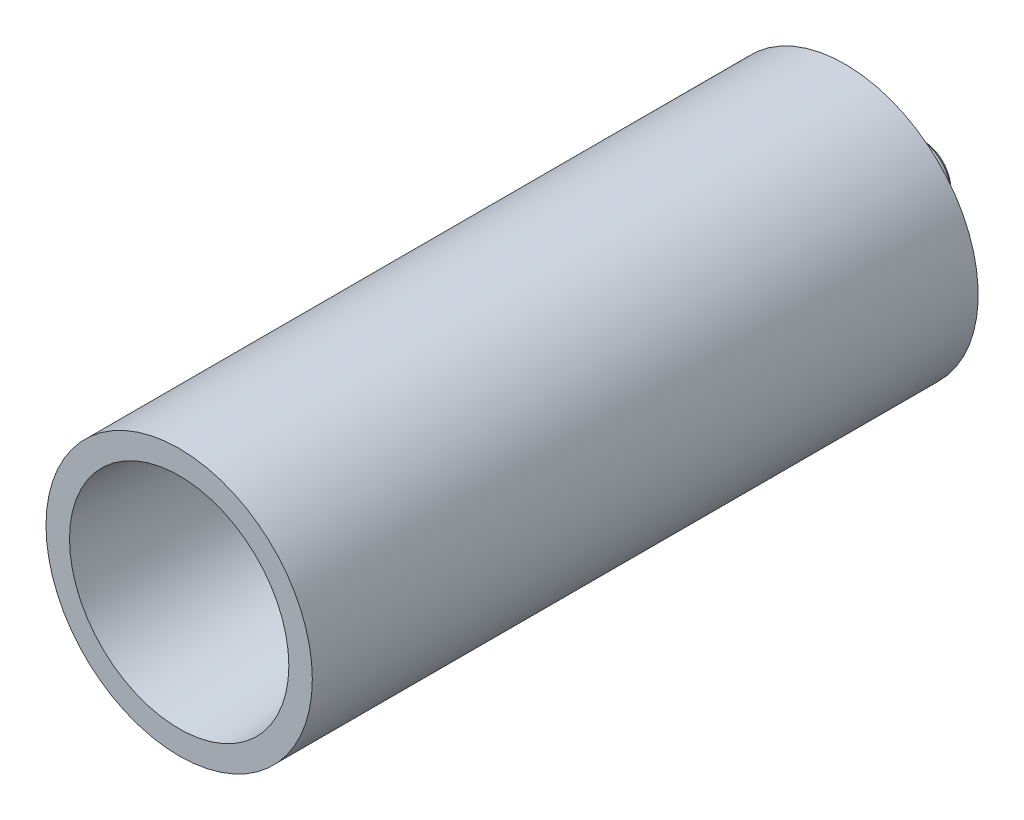
from build123d import *

# Parameters (mm, degrees)
SKETCH1_R           = 17
SKETCH1_R_2         = 12
BOSS_EXTRUDE1_DEPTH = 80
CHAMFER1_SIZE       = 2
CHAMFER1_SIZE2      = 22.860104606
BOSS_EXTRUDE2_START = 5
SKETCH2_R           = 17
BOSS_EXTRUDE2_DEPTH = 5
SKETCH3_R           = 9
SKETCH3_R_2         = 4
BOSS_EXTRUDE3_DEPTH = 3
BOSS_EXTRUDE4_START = 3
SKETCH3_3_R         = 4
BOSS_EXTRUDE4_DEPTH = 7
FILLET1_R           = 12
CHAMFER2_SIZE       = 0.5


with BuildPart() as part:
    # Sketch1 → Boss-Extrude1 (new body)
    with BuildSketch(Plane.XY):
        Circle(SKETCH1_R)
        Circle(SKETCH1_R_2, mode=Mode.SUBTRACT)
    extrude(amount=BOSS_EXTRUDE1_DEPTH)

    # Chamfer1
    chamfer1_edges = [part.edges().sort_by_distance(p)[0] for p in [
        (-12, 0, 80),
    ]]
    chamfer1_side = [part.faces().sort_by_distance(p)[0] for p in [
        (-16.519167389, 0, 80),
    ]]
    chamfer(chamfer1_edges, length=CHAMFER1_SIZE, length2=CHAMFER1_SIZE2, reference=chamfer1_side[0])

    # Sketch2 → Boss-Extrude2 (add)
    with BuildSketch(Plane(origin=(0, 0, 0), x_dir=(-1, 0, 0), z_dir=(0, 0, -1)).offset(BOSS_EXTRUDE2_START)):
        Circle(SKETCH2_R)
    extrude(amount=-BOSS_EXTRUDE2_DEPTH)

    # Sketch3 → Boss-Extrude3 (add)
    # profile 1 of 2: a face of its own
    with BuildSketch(Plane(origin=(0, 0, -5), x_dir=(-1, 0, 0), z_dir=(0, 0, -1))):
        Circle(SKETCH3_R)
        Circle(SKETCH3_R_2, mode=Mode.SUBTRACT)
    # profile 2 of 2: a face of its own
    with BuildSketch(Plane(origin=(0, 0, -5), x_dir=(-1, 0, 0), z_dir=(0, 0, -1))):
        Circle(SKETCH3_R_2)
    extrude(amount=BOSS_EXTRUDE3_DEPTH)

    # Sketch3<3> → Boss-Extrude4 (add)
    with BuildSketch(Plane(origin=(0, 0, -5), x_dir=(-1, 0, 0), z_dir=(0, 0, -1)).offset(BOSS_EXTRUDE4_START)):
        Circle(SKETCH3_3_R)
    extrude(amount=BOSS_EXTRUDE4_DEPTH)

    # Fillet1
    # the kernel refuses this fillet: 12 mm, written as the material it adds along each edge
    with BuildSketch(Plane(origin=(0, 0, -5), x_dir=(-1, 0, 0), z_dir=(0, -1, 0))) as fillet1_piece_1:
        with BuildLine():
            CenterArc((16.937253933, 12), FILLET1_R, 228.590377891, 41.409622109)
            Line((9, 3), (9, 0))
            Line((9, 0), (16.937253933, 0))
        make_face()
    revolve(axis=Axis((0, 0, -5), (0, 0, -1)))

    # Chamfer2
    chamfer2_edges = [part.edges().sort_by_distance(p)[0] for p in [
        (4, 0, -15),
    ]]
    chamfer(chamfer2_edges, length=CHAMFER2_SIZE)


solid = part.part
